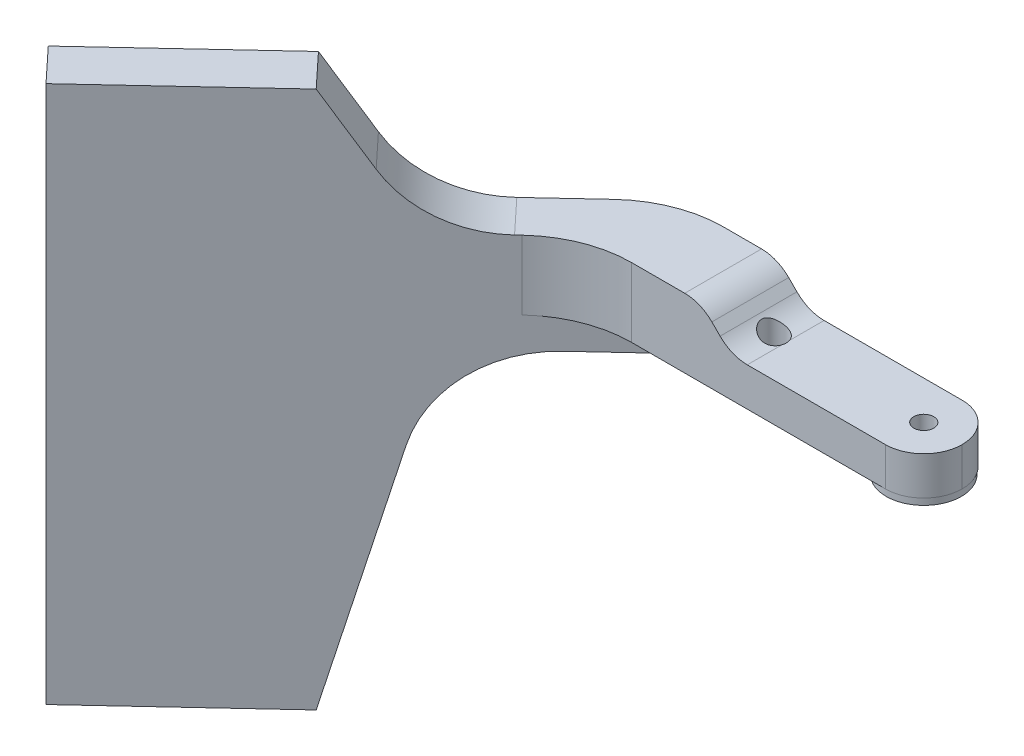
from build123d import *

# Parameters (mm, degrees)
BOSS_EXTRUDE1_DEPTH = 5
FILLET1_R           = 5
SKETCH2_R           = 1.2999999999999945
CUT_EXTRUDE1_DEPTH  = 10
BOSS_EXTRUDE2_DEPTH = 20
BOSS_EXTRUDE3_DEPTH = 45
BOSS_EXTRUDE4_DEPTH = 6
SKETCH6_R           = 4.900000000000002
SKETCH6_R_2         = 1.299999999999994
BOSS_EXTRUDE5_DEPTH = 0.9
BOSS_EXTRUDE6_DEPTH = 3.9999999999999964
BOSS_EXTRUDE7_DEPTH = 3.9999999999999964
FILLET2_R           = 15
FILLET7_SIZE        = 5
FILLET8_R           = 5
SKETCH11_R          = 1.6000000000000019
CUT_EXTRUDE2_DEPTH  = 10


# Some blends are built 0.0001 mm under size
with BuildPart() as part:
    # Sketch1 → Boss-Extrude1 (new body)
    with BuildSketch(Plane(origin=(0, 0, 0), x_dir=(1, 0, 0), z_dir=(0, 1, 0))):
        Polygon((4.091990160374978, 5.611877790284978), (0, 10), (0, 1.79603523340848), align=None)
        Polygon((0, 1.79603523340848), (0, 10), (-42.4185146939121, -29.55590488362469), (-38.32652453353713, -33.94402709333974), (-1.9260119864091507, 0), align=None)
        Polygon((42, 10), (0, 10), (4.091990160374978, 5.611877790284978), (0, 1.7960352334084817), (0, 0), (42, 0), align=None)
        Polygon((0, 0), (0, 1.79603523340848), (-1.9260119864091507, 0), align=None)
    extrude(amount=BOSS_EXTRUDE1_DEPTH)

    # Fillet1
    fillet1_edges = [part.edges().sort_by_distance(p)[0] for p in [
        (42, 2.5, 0),
        (42, 2.5, -10),
    ]]
    fillet(fillet1_edges, radius=FILLET1_R - 0.0001)  # a hair under: the kernel refuses the full size

    # Sketch2 → Cut-Extrude1 (cut)
    with BuildSketch(Plane(origin=(0, 5, 0), x_dir=(1, 0, 0), z_dir=(0, 1, 0))):
        with Locations(Location((37.00000000000001, 4.999999999999989, 0), (0, 0, 270))):
            Circle(SKETCH2_R)
    extrude(amount=-CUT_EXTRUDE1_DEPTH, mode=Mode.SUBTRACT)

    # Sketch3 → Boss-Extrude2 (add)
    with BuildSketch(Plane(origin=(0, 5, 0), x_dir=(1, 0, 0), z_dir=(0, 1, 0))):
        Polygon((-42.4185146939121, -29.55590488362471), (-38.32652453353713, -33.94402709333974), (-20.126268259973138, -16.97201354666987), (-24.21825842034811, -12.583891336954824), align=None)
    extrude(amount=BOSS_EXTRUDE2_DEPTH)

    # Sketch4 → Boss-Extrude3 (add)
    with BuildSketch(Plane.XZ):
        Polygon((-42.4185146939121, 29.55590488362471), (-38.32652453353713, 33.94402709333974), (-20.126268259973134, 16.972013546669885), (-24.218258420348107, 12.583891336954828), align=None)
    extrude(amount=BOSS_EXTRUDE3_DEPTH)

    # Sketch5 → Boss-Extrude4 (add)
    with BuildSketch(Plane(origin=(-4.987820251299118, 0, -5.348782368720677), x_dir=(-0.7313537016191739, 0, 0.6819983600624947), z_dir=(-0.6819983600624948, 0, -0.731353701619174))):
        Polygon((26.29430619749914, -45), (26.29430619749914, 0), (13.888976828400956, 0), align=None)
        Polygon((13.888976828400958, 5), (26.29430619749914, 25), (26.29430619749914, 5), align=None)
    extrude(amount=-BOSS_EXTRUDE4_DEPTH)

    # Sketch6 → Boss-Extrude5 (add)
    with BuildSketch(Plane.XZ):
        with Locations(Location((37.00000000000001, -4.999999999999989, 0), (0, 0, 90))):
            Circle(SKETCH6_R)
        with Locations(Location((37.00000000000001, -4.999999999999989, 0), (0, 0, 90))):
            Circle(SKETCH6_R_2, mode=Mode.SUBTRACT)
    extrude(amount=BOSS_EXTRUDE5_DEPTH)

    # Sketch8 → Boss-Extrude6 (add)
    with BuildSketch(Plane.XZ):
        Polygon((0, -10), (-19.681916643400598, 8.353684194074795), (-15.589926483025625, 12.741806403789838), (8.797675113837775, -10), align=None)
    extrude(amount=BOSS_EXTRUDE6_DEPTH)

    # Sketch9 → Boss-Extrude7 (add)
    with BuildSketch(Plane(origin=(0, 5, 0), x_dir=(1, 0, 0), z_dir=(0, 1, 0))):
        Polygon((0, 10), (-20.085147023573704, -8.729702606775238), (-16.79961762354496, -13.869861641891177), (-1.92601198640914, -7.11e-15), (17.950520425486616, 5.22e-15), (17.950520425486616, 10), align=None)
    extrude(amount=BOSS_EXTRUDE7_DEPTH)

    # Fillet2
    fillet2_edges = [part.edges().sort_by_distance(p)[0] for p in [
        (-14.914116497044613, 8.999999999999996, 8.009621013204297),
        (-1.9260119864091478, 4.499999999999998, 2.06e-15),
        (0, 2.5, -10),
        (-13.906040546611829, -3.9999999999999973, 7.069574981453184),
    ]]
    fillet(fillet2_edges, radius=FILLET2_R)

    # Fillet7
    # the kernel refuses this chamfer: 5 mm, written as the material it takes off along each edge
    with BuildSketch(Plane(origin=(17.950520425486616, 8.999999999999996, 12.858414939829549), x_dir=(0.027495876610586317, -0.9996219169112968, 0), z_dir=(0, 0, -1))) as fillet7_piece_1_section:
        Polygon((FILLET7_SIZE * 0.999621916911, FILLET7_SIZE * 0.0274958766106), (-FILLET7_SIZE * 0.0274958766106, FILLET7_SIZE * 0.999621916911), (0, 0), align=None)
    fillet7_piece_1 = extrude(amount=35.71682987965911, mode=Mode.PRIVATE)
    fillet7_piece_1 = split(fillet7_piece_1, bisect_by=Plane(origin=(16.221928363932022, 5, -5.000000000000004), z_dir=(0, 1, 0)), keep=Keep.TOP, mode=Mode.PRIVATE)
    add(fillet7_piece_1, mode=Mode.SUBTRACT)

    # Fillet8
    fillet8_edges = [part.edges().sort_by_distance(p)[0] for p in [
        (12.95052042548848, 8.999999999998002, -5.000000000000002),
        (16.950520425489678, 5, -4.999999999999999),
    ]]
    fillet(fillet8_edges, radius=FILLET8_R)

    # Sketch11 → Cut-Extrude2 (cut)
    with BuildSketch(Plane(origin=(0, 0, 0), x_dir=(-1, 0, 0), z_dir=(0, -1, 0))):
        with Locations(Location((-17.499999999999993, 5.000000000000053, 0), (0, 0, 90))):
            Circle(SKETCH11_R)
    extrude(amount=-CUT_EXTRUDE2_DEPTH, mode=Mode.SUBTRACT)


solid = part.part
